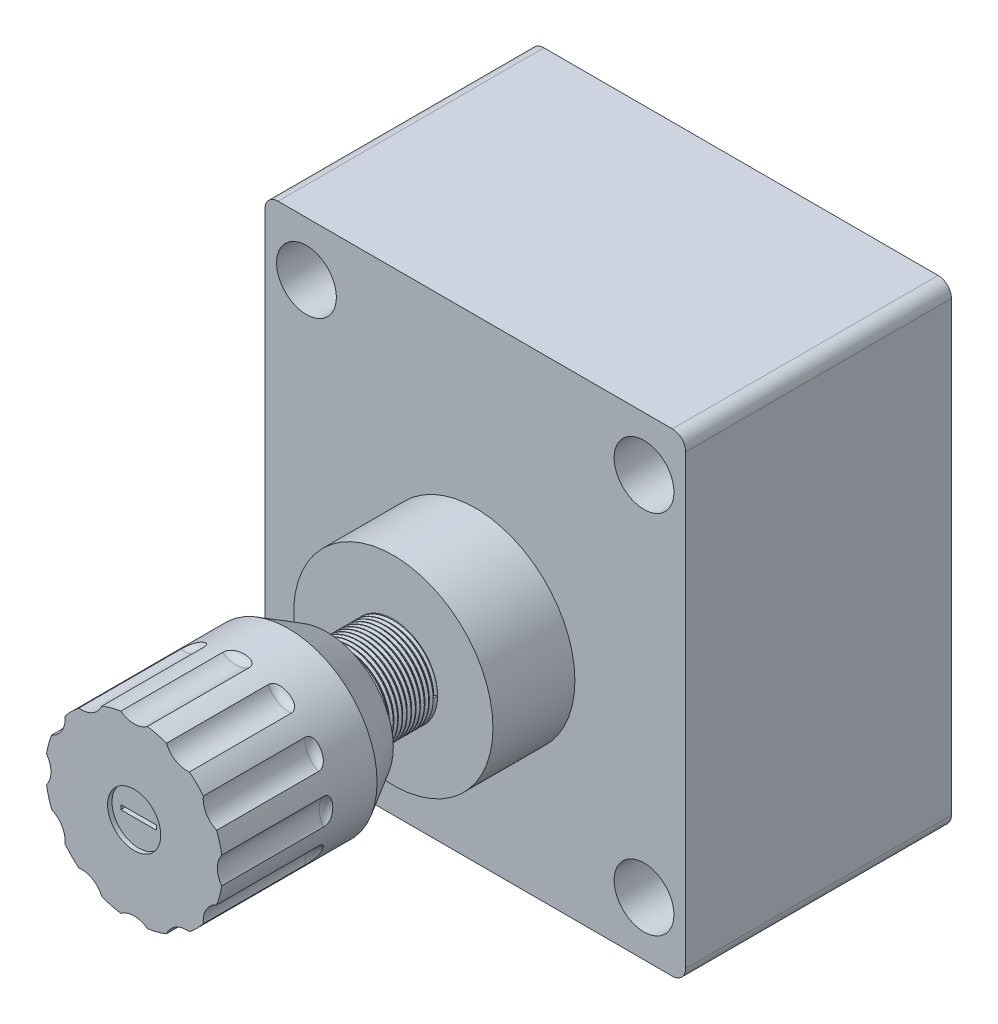
from build123d import *

# Parameters (mm, degrees)
SKETCH_1_W                       = 95
SKETCH_1_H                       = 107
SKETCH_1_R                       = 4
SKETCH_1_R_2                     = 6
SKETCH_1_R_3                     = 3.75
EXTRUDE_1_DEPTH                  = 60
SKETCH_2_R                       = 6.75
CUT_EXTRUDE_1_DEPTH              = 10
SKETCH_3_R                       = 6
SKETCH_3_R_2                     = 3.75
EXTRUDE_2_DEPTH                  = 20
FILLET_1_R                       = 3
SKETCH_7_R                       = 6
CUT_EXTRUDE_2_DEPTH              = 1
SKETCH_8_W                       = 8
SKETCH_8_H                       = 1
CUT_EXTRUDE_3_DEPTH              = 2
THREAD_1_PITCH                   = 1
CUT_EXTRUDE_4_DEPTH              = 25
FILLET_2_R                       = 2
PATTERN_CIRCULAR_1_COUNT         = 12
FILLET_2_OF_PATTERN_CIRCULAR_1_R = 2


with BuildPart() as part:
    # Sketch 1 → 凸台-拉伸1 (new body)
    with BuildSketch(Plane.XY):
        Rectangle(SKETCH_1_W, SKETCH_1_H)
        with Locations((-38.1, 41.3)):
            Circle(SKETCH_1_R, mode=Mode.SUBTRACT)
        with Locations((38.1, 41.3)):
            Circle(SKETCH_1_R, mode=Mode.SUBTRACT)
        with Locations((38.1, -41.3)):
            Circle(SKETCH_1_R, mode=Mode.SUBTRACT)
        with Locations((-38.1, -41.3)):
            Circle(SKETCH_1_R, mode=Mode.SUBTRACT)
        with Locations((15.9, 30.2)):
            Circle(SKETCH_1_R_2, mode=Mode.SUBTRACT)
        with Locations((-28.6, -11.1)):
            Circle(SKETCH_1_R_2, mode=Mode.SUBTRACT)
        with Locations((41.3, 17.5)):
            Circle(SKETCH_1_R_3, mode=Mode.SUBTRACT)
    extrude(amount=-EXTRUDE_1_DEPTH)

    # 草图2 → 切除-拉伸1 (cut)
    with BuildSketch(Plane.XY):
        with Locations((-38.1, 41.3)):
            Circle(SKETCH_2_R)
        with Locations((-38.1, -41.3)):
            Circle(SKETCH_2_R)
        with Locations((38.1, -41.3)):
            Circle(SKETCH_2_R)
        with Locations((38.1, 41.3)):
            Circle(SKETCH_2_R)
    extrude(amount=-CUT_EXTRUDE_1_DEPTH, mode=Mode.SUBTRACT)

    # 草图3 → 凸台-拉伸2 (add)
    with BuildSketch(Plane.XY):
        with Locations((15.9, 30.2)):
            Circle(SKETCH_3_R)
        with Locations((41.3, 17.5)):
            Circle(SKETCH_3_R_2)
        with Locations((-28.6, -11.1)):
            Circle(SKETCH_3_R)
    extrude(amount=-EXTRUDE_2_DEPTH)

    # 草图5 → 旋转1 (revolve)
    with BuildSketch(Plane(origin=(0, 0, 0), x_dir=(0, 0, -1), z_dir=(1, 0, 0)), mode=Mode.PRIVATE) as revolve_1_sk:
        Polygon((0, -29.2), (-18.5, -29.2), (-18.5, -16.7), (-33.5, -16.7), (-33.5, -21.7), (-42.160254038, -26.7), (-77, -26.7), (-77, -6.7), (0, -6.7), align=None)
    revolve(revolve_1_sk.sketch.rotate(Axis((0, -6.7, 85.206195198), (0, 0, -1)), 270), axis=Axis((0, -6.7, 85.206195198), (0, 0, -1)))

    # 圆角1
    fillet_1_edges = [part.edges().sort_by_distance(p)[0] for p in [
        (47.5, -53.5, -30),
        (-47.5, -53.5, -30),
        (-47.5, 53.5, -30),
        (47.5, 53.5, -30),
    ]]
    fillet(fillet_1_edges, radius=FILLET_1_R)

    # 草图7 → 切除-拉伸2 (cut)
    with BuildSketch(Plane.XY.offset(77)):
        with Locations((0, -6.7)):
            Circle(SKETCH_7_R)
    extrude(amount=-CUT_EXTRUDE_2_DEPTH, mode=Mode.SUBTRACT)

    # 草图8 → 切除-拉伸3 (cut)
    with BuildSketch(Plane.XY.offset(76)):
        with Locations((0, -6.7)):
            Rectangle(SKETCH_8_W, SKETCH_8_H)
    extrude(amount=-CUT_EXTRUDE_3_DEPTH, mode=Mode.SUBTRACT)

    # 螺纹线1: the profile of Sketch 1 2 profile screwed along a right-hand helix of 15 turns, 8 arcs to a turn; built about Z, then put on its axis
    thread_1_z = Axis((0, 0, 0), (0, 0, 1))
    thread_1_corners = [(10.0003, 0, -0.000173205), (10.0003, 0, 0.875173202), (9.458734125, 0, 0.562499999), (9.458734125, 0, 0.312499999)]
    with BuildLine(mode=Mode.PRIVATE) as thread_1_profile:
        Line(thread_1_corners[0], thread_1_corners[1])
        Line(thread_1_corners[1], thread_1_corners[2])
        Line(thread_1_corners[2], thread_1_corners[3])
        Line(thread_1_corners[3], thread_1_corners[0])
    thread_1_cap = Face(thread_1_profile.wire())
    thread_1_turn_angles = [0, 22.5, 45, 67.5, 90, 112.5, 135, 157.5, 180, 202.5, 225, 247.5, 270, 292.5, 315, 337.5, 360]
    thread_1_turn_weights = [1, 0.9238795325112867, 1, 0.9238795325112867, 1, 0.9238795325112867, 1, 0.9238795325112867, 1, 0.9238795325112867, 1, 0.9238795325112867, 1, 0.9238795325112867, 1, 0.9238795325112867, 1]
    thread_1_turn_rails = [Edge.make_bspline([Vector(p[0], p[1], 0).rotate(thread_1_z, thread_1_turn_angles[k]) / thread_1_turn_weights[k] + Vector(0, 0, p[2] + THREAD_1_PITCH * thread_1_turn_angles[k] / 360) for k in range(17)], [0, 0, 0, 1, 1, 2, 2, 3, 3, 4, 4, 5, 5, 6, 6, 7, 7, 8, 8, 8], 2, thread_1_turn_weights) for p in thread_1_corners]
    thread_1_turn_sides = [Face.make_surface_from_curves(thread_1_turn_rails[p[0]], thread_1_turn_rails[p[1]]) for p in [(0, 1), (1, 2), (2, 3), (3, 0)]]
    thread_1 = Plane(origin=(0, -6.7, 18.5), x_dir=(1, 0, 0), z_dir=(0, 0, 1)) * Solid(Shell([*[p.moved(Location((0, 0, THREAD_1_PITCH * i))) for i in range(15) for p in thread_1_turn_sides], thread_1_cap, thread_1_cap.rotate(thread_1_z, 5400).moved(Location((0, 0, THREAD_1_PITCH * 5400 / 360)))]))
    add(thread_1, mode=Mode.SUBTRACT)

    # 草图9 → 切除-拉伸4 (cut)
    with BuildSketch(Plane.XY.offset(77)):
        with BuildLine():
            ThreePointArc((-3, 13.073719933), (0, 12.073719933), (3, 13.073719933))
            ThreePointArc((3, 13.073719933), (0, 13.3), (-3, 13.073719933))
        make_face()
    cut_extrude_4 = extrude(amount=-CUT_EXTRUDE_4_DEPTH, mode=Mode.SUBTRACT)

    # 圆角2
    # the kernel refuses this fillet: 2 mm, written as the material it adds along each edge
    with BuildSketch(Plane(origin=(0, 17.073719933, 52), x_dir=(-0.9973385480321628, 0.07290967431759095, 0), z_dir=(0.07290967431759095, 0.9973385480321628, 0))) as fillet_2_piece_1_section:
        with BuildLine():
            CenterArc((5 - FILLET_2_R, FILLET_2_R), FILLET_2_R, 270, 90)
            Line((5 - FILLET_2_R, 0), (5, 0))
            Line((5, 0), (5, FILLET_2_R))
        make_face()
    fillet_2_piece_1 = revolve(axis=Axis((0, 17.073719933, 52), (0, 0, 1)), revolution_arc=188.362253144, mode=Mode.PRIVATE)
    fillet_2_piece_1 = fillet_2_piece_1 & Plane(origin=(0, -6.7, 52.54735662), x_dir=(1, 0, 0), z_dir=(0, 0, 1)) * Cylinder(20, 20, mode=Mode.PRIVATE)
    add(fillet_2_piece_1)

    # 阵列(圆周)1: 切除-拉伸4 ×12 about axis
    pattern_circular_1_axis = Axis((0, -6.7, 0), (0, 0, 1))
    for i in range(1, PATTERN_CIRCULAR_1_COUNT):
        add(cut_extrude_4.rotate(pattern_circular_1_axis, i * 360 / PATTERN_CIRCULAR_1_COUNT), mode=Mode.SUBTRACT)

    # 圆角2 of 阵列(圆周)1
    # the kernel refuses this fillet: 2 mm, written as the material it adds along each edge
    with BuildSketch(Plane(origin=(-11.886859967, 13.888645405, 52), x_dir=(-0.9001753559281354, -0.43552764387539744, 0), z_dir=(-0.43552764387539744, 0.9001753559281354, 0))) as fillet_2_of_pattern_circular_1_piece_1_section:
        with BuildLine():
            CenterArc((5 - FILLET_2_OF_PATTERN_CIRCULAR_1_R, FILLET_2_OF_PATTERN_CIRCULAR_1_R), FILLET_2_OF_PATTERN_CIRCULAR_1_R, 270, 90)
            Line((5 - FILLET_2_OF_PATTERN_CIRCULAR_1_R, 0), (5, 0))
            Line((5, 0), (5, FILLET_2_OF_PATTERN_CIRCULAR_1_R))
        make_face()
    fillet_2_of_pattern_circular_1_piece_1 = revolve(axis=Axis((-11.886859967, 13.888645405, 52), (0, 0, 1)), revolution_arc=188.362253144, mode=Mode.PRIVATE)
    fillet_2_of_pattern_circular_1_piece_1 = fillet_2_of_pattern_circular_1_piece_1 & Plane(origin=(0, -6.7, 52.547356638), x_dir=(1, 0, 0), z_dir=(0, 0, 1)) * Cylinder(20, 20, mode=Mode.PRIVATE)
    add(fillet_2_of_pattern_circular_1_piece_1)
    with BuildSketch(Plane(origin=(-20.588645405, 5.186859967, 52), x_dir=(-0.5618109041567657, -0.8272656816105436, 0), z_dir=(-0.8272656816105436, 0.5618109041567657, 0))) as fillet_2_of_pattern_circular_1_piece_2_section:
        with BuildLine():
            CenterArc((5 - FILLET_2_OF_PATTERN_CIRCULAR_1_R, FILLET_2_OF_PATTERN_CIRCULAR_1_R), FILLET_2_OF_PATTERN_CIRCULAR_1_R, 270, 90)
            Line((5 - FILLET_2_OF_PATTERN_CIRCULAR_1_R, 0), (5, 0))
            Line((5, 0), (5, FILLET_2_OF_PATTERN_CIRCULAR_1_R))
        make_face()
    fillet_2_of_pattern_circular_1_piece_2 = revolve(axis=Axis((-20.588645405, 5.186859967, 52), (0, 0, 1)), revolution_arc=188.362253144, mode=Mode.PRIVATE)
    fillet_2_of_pattern_circular_1_piece_2 = fillet_2_of_pattern_circular_1_piece_2 & Plane(origin=(0, -6.7, 52.547356638), x_dir=(1, 0, 0), z_dir=(0, 0, 1)) * Cylinder(20, 20, mode=Mode.PRIVATE)
    add(fillet_2_of_pattern_circular_1_piece_2)
    with BuildSketch(Plane(origin=(-23.773719933, -6.7, 52), x_dir=(-0.07290967431759025, -0.997338548032163, 0), z_dir=(-0.997338548032163, 0.07290967431759025, 0))) as fillet_2_of_pattern_circular_1_piece_3_section:
        with BuildLine():
            CenterArc((5 - FILLET_2_OF_PATTERN_CIRCULAR_1_R, FILLET_2_OF_PATTERN_CIRCULAR_1_R), FILLET_2_OF_PATTERN_CIRCULAR_1_R, 270, 90)
            Line((5 - FILLET_2_OF_PATTERN_CIRCULAR_1_R, 0), (5, 0))
            Line((5, 0), (5, FILLET_2_OF_PATTERN_CIRCULAR_1_R))
        make_face()
    fillet_2_of_pattern_circular_1_piece_3 = revolve(axis=Axis((-23.773719933, -6.7, 52), (0, 0, 1)), revolution_arc=188.362253144, mode=Mode.PRIVATE)
    fillet_2_of_pattern_circular_1_piece_3 = fillet_2_of_pattern_circular_1_piece_3 & Plane(origin=(0, -6.7, 52.547356638), x_dir=(1, 0, 0), z_dir=(0, 0, 1)) * Cylinder(20, 20, mode=Mode.PRIVATE)
    add(fillet_2_of_pattern_circular_1_piece_3)
    with BuildSketch(Plane(origin=(-20.588645405, -18.586859967, 52), x_dir=(0.43552764387539744, -0.9001753559281354, 0), z_dir=(-0.9001753559281354, -0.43552764387539744, 0))) as fillet_2_of_pattern_circular_1_piece_4_section:
        with BuildLine():
            CenterArc((5 - FILLET_2_OF_PATTERN_CIRCULAR_1_R, FILLET_2_OF_PATTERN_CIRCULAR_1_R), FILLET_2_OF_PATTERN_CIRCULAR_1_R, 270, 90)
            Line((5 - FILLET_2_OF_PATTERN_CIRCULAR_1_R, 0), (5, 0))
            Line((5, 0), (5, FILLET_2_OF_PATTERN_CIRCULAR_1_R))
        make_face()
    fillet_2_of_pattern_circular_1_piece_4 = revolve(axis=Axis((-20.588645405, -18.586859967, 52), (0, 0, 1)), revolution_arc=188.362253144, mode=Mode.PRIVATE)
    fillet_2_of_pattern_circular_1_piece_4 = fillet_2_of_pattern_circular_1_piece_4 & Plane(origin=(0, -6.7, 52.547356638), x_dir=(1, 0, 0), z_dir=(0, 0, 1)) * Cylinder(20, 20, mode=Mode.PRIVATE)
    add(fillet_2_of_pattern_circular_1_piece_4)
    with BuildSketch(Plane(origin=(-11.886859967, -27.288645405, 52), x_dir=(0.8272656816105447, -0.5618109041567643, 0), z_dir=(-0.5618109041567643, -0.8272656816105447, 0))) as fillet_2_of_pattern_circular_1_piece_5_section:
        with BuildLine():
            CenterArc((5 - FILLET_2_OF_PATTERN_CIRCULAR_1_R, FILLET_2_OF_PATTERN_CIRCULAR_1_R), FILLET_2_OF_PATTERN_CIRCULAR_1_R, 270, 90)
            Line((5 - FILLET_2_OF_PATTERN_CIRCULAR_1_R, 0), (5, 0))
            Line((5, 0), (5, FILLET_2_OF_PATTERN_CIRCULAR_1_R))
        make_face()
    fillet_2_of_pattern_circular_1_piece_5 = revolve(axis=Axis((-11.886859967, -27.288645405, 52), (0, 0, 1)), revolution_arc=188.362253144, mode=Mode.PRIVATE)
    fillet_2_of_pattern_circular_1_piece_5 = fillet_2_of_pattern_circular_1_piece_5 & Plane(origin=(0, -6.7, 52.547356638), x_dir=(1, 0, 0), z_dir=(0, 0, 1)) * Cylinder(20, 20, mode=Mode.PRIVATE)
    add(fillet_2_of_pattern_circular_1_piece_5)
    with BuildSketch(Plane(origin=(0, -30.473719933, 52), x_dir=(0.9973385480321628, -0.07290967431759024, 0), z_dir=(-0.07290967431759024, -0.9973385480321628, 0))) as fillet_2_of_pattern_circular_1_piece_6_section:
        with BuildLine():
            CenterArc((5 - FILLET_2_OF_PATTERN_CIRCULAR_1_R, FILLET_2_OF_PATTERN_CIRCULAR_1_R), FILLET_2_OF_PATTERN_CIRCULAR_1_R, 270, 90)
            Line((5 - FILLET_2_OF_PATTERN_CIRCULAR_1_R, 0), (5, 0))
            Line((5, 0), (5, FILLET_2_OF_PATTERN_CIRCULAR_1_R))
        make_face()
    fillet_2_of_pattern_circular_1_piece_6 = revolve(axis=Axis((0, -30.473719933, 52), (0, 0, 1)), revolution_arc=188.362253144, mode=Mode.PRIVATE)
    fillet_2_of_pattern_circular_1_piece_6 = fillet_2_of_pattern_circular_1_piece_6 & Plane(origin=(0, -6.7, 52.547356638), x_dir=(1, 0, 0), z_dir=(0, 0, 1)) * Cylinder(20, 20, mode=Mode.PRIVATE)
    add(fillet_2_of_pattern_circular_1_piece_6)
    with BuildSketch(Plane(origin=(11.886859967, -27.288645405, 52), x_dir=(0.9001753559281349, 0.43552764387539816, 0), z_dir=(0.43552764387539816, -0.9001753559281349, 0))) as fillet_2_of_pattern_circular_1_piece_7_section:
        with BuildLine():
            CenterArc((5 - FILLET_2_OF_PATTERN_CIRCULAR_1_R, FILLET_2_OF_PATTERN_CIRCULAR_1_R), FILLET_2_OF_PATTERN_CIRCULAR_1_R, 270, 90)
            Line((5 - FILLET_2_OF_PATTERN_CIRCULAR_1_R, 0), (5, 0))
            Line((5, 0), (5, FILLET_2_OF_PATTERN_CIRCULAR_1_R))
        make_face()
    fillet_2_of_pattern_circular_1_piece_7 = revolve(axis=Axis((11.886859967, -27.288645405, 52), (0, 0, 1)), revolution_arc=188.362253144, mode=Mode.PRIVATE)
    fillet_2_of_pattern_circular_1_piece_7 = fillet_2_of_pattern_circular_1_piece_7 & Plane(origin=(0, -6.7, 52.547356638), x_dir=(1, 0, 0), z_dir=(0, 0, 1)) * Cylinder(20, 20, mode=Mode.PRIVATE)
    add(fillet_2_of_pattern_circular_1_piece_7)
    with BuildSketch(Plane(origin=(20.588645405, -18.586859967, 52), x_dir=(0.5618109041567654, 0.8272656816105439, 0), z_dir=(0.8272656816105439, -0.5618109041567654, 0))) as fillet_2_of_pattern_circular_1_piece_8_section:
        with BuildLine():
            CenterArc((5 - FILLET_2_OF_PATTERN_CIRCULAR_1_R, FILLET_2_OF_PATTERN_CIRCULAR_1_R), FILLET_2_OF_PATTERN_CIRCULAR_1_R, 270, 90)
            Line((5 - FILLET_2_OF_PATTERN_CIRCULAR_1_R, 0), (5, 0))
            Line((5, 0), (5, FILLET_2_OF_PATTERN_CIRCULAR_1_R))
        make_face()
    fillet_2_of_pattern_circular_1_piece_8 = revolve(axis=Axis((20.588645405, -18.586859967, 52), (0, 0, 1)), revolution_arc=188.362253144, mode=Mode.PRIVATE)
    fillet_2_of_pattern_circular_1_piece_8 = fillet_2_of_pattern_circular_1_piece_8 & Plane(origin=(0, -6.7, 52.547356638), x_dir=(1, 0, 0), z_dir=(0, 0, 1)) * Cylinder(20, 20, mode=Mode.PRIVATE)
    add(fillet_2_of_pattern_circular_1_piece_8)
    with BuildSketch(Plane(origin=(23.773719933, -6.7, 52), x_dir=(0.07290967431759025, 0.997338548032163, 0), z_dir=(0.997338548032163, -0.07290967431759025, 0))) as fillet_2_of_pattern_circular_1_piece_9_section:
        with BuildLine():
            CenterArc((5 - FILLET_2_OF_PATTERN_CIRCULAR_1_R, FILLET_2_OF_PATTERN_CIRCULAR_1_R), FILLET_2_OF_PATTERN_CIRCULAR_1_R, 270, 90)
            Line((5 - FILLET_2_OF_PATTERN_CIRCULAR_1_R, 0), (5, 0))
            Line((5, 0), (5, FILLET_2_OF_PATTERN_CIRCULAR_1_R))
        make_face()
    fillet_2_of_pattern_circular_1_piece_9 = revolve(axis=Axis((23.773719933, -6.7, 52), (0, 0, 1)), revolution_arc=188.362253144, mode=Mode.PRIVATE)
    fillet_2_of_pattern_circular_1_piece_9 = fillet_2_of_pattern_circular_1_piece_9 & Plane(origin=(0, -6.7, 52.547356801), x_dir=(1, 0, 0), z_dir=(0, 0, 1)) * Cylinder(20, 20, mode=Mode.PRIVATE)
    add(fillet_2_of_pattern_circular_1_piece_9)
    with BuildSketch(Plane(origin=(20.588645405, 5.186859967, 52), x_dir=(-0.4355276438753986, 0.9001753559281347, 0), z_dir=(0.9001753559281347, 0.4355276438753986, 0))) as fillet_2_of_pattern_circular_1_piece_10_section:
        with BuildLine():
            CenterArc((5 - FILLET_2_OF_PATTERN_CIRCULAR_1_R, FILLET_2_OF_PATTERN_CIRCULAR_1_R), FILLET_2_OF_PATTERN_CIRCULAR_1_R, 270, 90)
            Line((5 - FILLET_2_OF_PATTERN_CIRCULAR_1_R, 0), (5, 0))
            Line((5, 0), (5, FILLET_2_OF_PATTERN_CIRCULAR_1_R))
        make_face()
    fillet_2_of_pattern_circular_1_piece_10 = revolve(axis=Axis((20.588645405, 5.186859967, 52), (0, 0, 1)), revolution_arc=188.362253144, mode=Mode.PRIVATE)
    fillet_2_of_pattern_circular_1_piece_10 = fillet_2_of_pattern_circular_1_piece_10 & Plane(origin=(0, -6.7, 52.547356638), x_dir=(1, 0, 0), z_dir=(0, 0, 1)) * Cylinder(20, 20, mode=Mode.PRIVATE)
    add(fillet_2_of_pattern_circular_1_piece_10)
    with BuildSketch(Plane(origin=(11.886859967, 13.888645405, 52), x_dir=(-0.8272656816105437, 0.5618109041567655, 0), z_dir=(0.5618109041567655, 0.8272656816105437, 0))) as fillet_2_of_pattern_circular_1_piece_11_section:
        with BuildLine():
            CenterArc((5 - FILLET_2_OF_PATTERN_CIRCULAR_1_R, FILLET_2_OF_PATTERN_CIRCULAR_1_R), FILLET_2_OF_PATTERN_CIRCULAR_1_R, 270, 90)
            Line((5 - FILLET_2_OF_PATTERN_CIRCULAR_1_R, 0), (5, 0))
            Line((5, 0), (5, FILLET_2_OF_PATTERN_CIRCULAR_1_R))
        make_face()
    fillet_2_of_pattern_circular_1_piece_11 = revolve(axis=Axis((11.886859967, 13.888645405, 52), (0, 0, 1)), revolution_arc=188.362253144, mode=Mode.PRIVATE)
    fillet_2_of_pattern_circular_1_piece_11 = fillet_2_of_pattern_circular_1_piece_11 & Plane(origin=(0, -6.7, 52.547356638), x_dir=(1, 0, 0), z_dir=(0, 0, 1)) * Cylinder(20, 20, mode=Mode.PRIVATE)
    add(fillet_2_of_pattern_circular_1_piece_11)


solid = part.part
